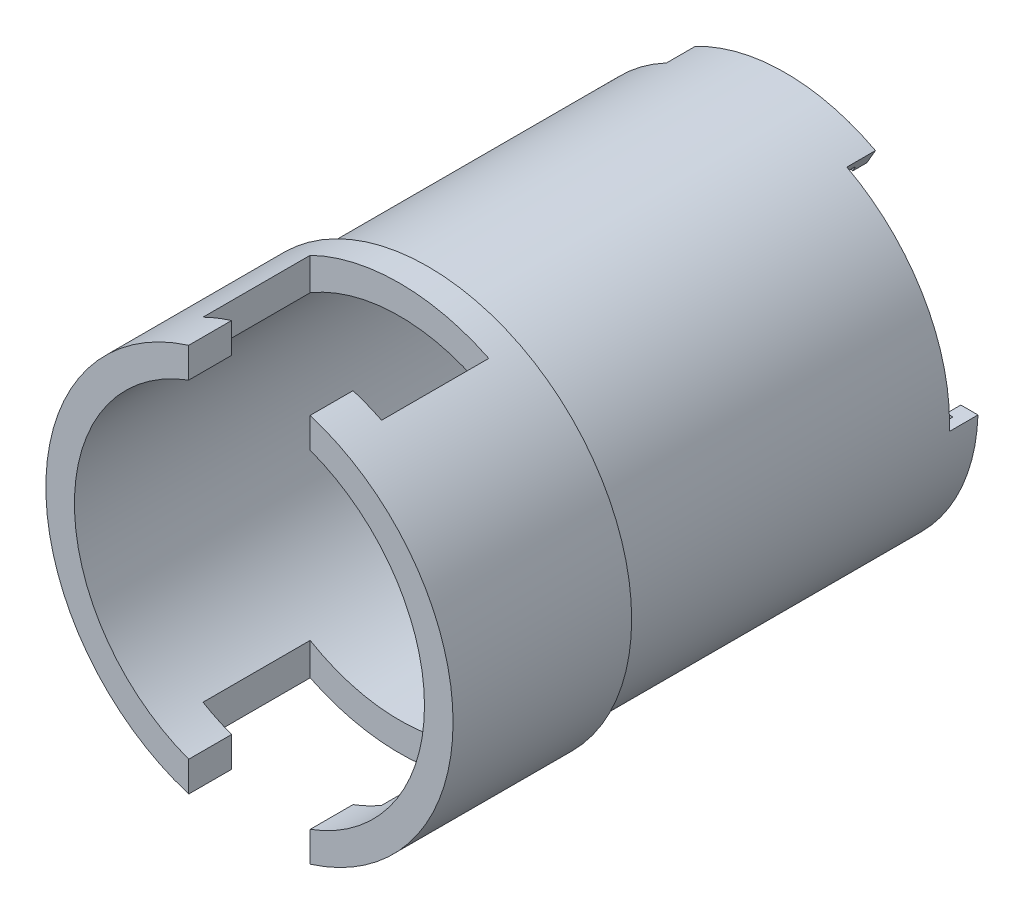
from build123d import *

# Parameters (mm, degrees)
CUT_EXTRUDE_4_DEPTH      = 4
PATTERN_CIRCULAR_1_COUNT = 3
CUT_EXTRUDE_7_DEPTH      = 86.143936954
CUT_EXTRUDE_7_DEPTH_BACK = 86.143936954
SKETCH_12_W              = 25
SKETCH_12_H              = 15
CUT_EXTRUDE_START        = -6
SKETCH_13_W              = 17
SKETCH_13_H              = 62.633188826
CUT_EXTRUDE_12_DEPTH     = 6
CHAMFER_2_SIZE           = 0.3
CHAMFER_2_SIZE2          = 0.519615242
SKETCH_14_W              = 2
SKETCH_14_H              = 10
SKETCH_16_W              = 3
SKETCH_16_H              = 60.736072742
CUT_EXTRUDE_14_DEPTH     = 3
CHAMFER_3_SIZE           = 1
CUT_EXTRUDE_13_REACH     = 102.772


with BuildPart() as part:
    # Эскиз1 → Повернуть1 (revolve)
    with BuildSketch(Plane(origin=(0, 0, 0), x_dir=(0, 0, -1), z_dir=(1, 0, 0)), mode=Mode.PRIVATE) as revolve_1_sk:
        Polygon((0, 24.5), (70.999933333, 24.5), (70.999933333, 25.5), (72.999933333, 25.5), (72.999933333, 24.6), (74.999933333, 24.6), (74.999933333, 27), (25, 27), (25, 28.5), (0, 28.5), align=None)
    revolve(revolve_1_sk.sketch.rotate(Axis((0, 0, 0), (0, 0, -1)), 90), axis=Axis((0, 0, 0), (0, 0, -1)))

    # Эскиз9 → Вырез-Вытянуть4 (cut)
    with BuildSketch(Plane(origin=(0, 0, -74.999933333), x_dir=(-1, 0, 0), z_dir=(0, 0, -1))):
        with BuildLine():
            ThreePointArc((24.6, 0), (24.594916073, -0.500103353), (24.579666393, -1))
            Line((24.579666393, -1), (26.981475126, -1))
            ThreePointArc((26.981475126, -1), (26.995368384, -0.500085785), (27, 0))
            ThreePointArc((27, 0), (23.128631913, 13.930771186), (12.624712159, 23.866642891))
            Line((12.624712159, 23.866642891), (11.423807793, 21.786615513))
            ThreePointArc((11.423807793, 21.786615513), (21.049770447, 12.730560245), (24.6, 0))
        make_face()
    cut_extrude_4 = extrude(amount=-CUT_EXTRUDE_4_DEPTH, mode=Mode.SUBTRACT)

    # Круговой массив1: Вырез-Вытянуть4 ×3 about axis
    pattern_circular_1_axis = Axis((0, 0, 0), (0, 0, 1))
    for i in range(1, PATTERN_CIRCULAR_1_COUNT):
        add(cut_extrude_4.rotate(pattern_circular_1_axis, i * 360 / PATTERN_CIRCULAR_1_COUNT), mode=Mode.SUBTRACT)

    # Эскиз12 → Вырез-Вытянуть7 (cut, two sides: drawn at the far end of the back side and taken through both)
    with BuildSketch(Plane(origin=(0, 0, 0), x_dir=(1, 0, 0), z_dir=(0, 1, 0)).offset(-CUT_EXTRUDE_7_DEPTH_BACK)):
        with Locations((0, 13.5)):
            Rectangle(SKETCH_12_W, SKETCH_12_H)
    extrude(amount=CUT_EXTRUDE_7_DEPTH + CUT_EXTRUDE_7_DEPTH_BACK, mode=Mode.SUBTRACT)

    # Эскиз13 → Вырез-Вытянуть12 (cut)
    with BuildSketch(Plane.XY.offset(CUT_EXTRUDE_START)):
        Rectangle(SKETCH_13_W, SKETCH_13_H)
    extrude(amount=CUT_EXTRUDE_12_DEPTH, mode=Mode.SUBTRACT)

    # Фаска2
    chamfer_2_edges = [part.edges().sort_by_distance(p)[0] for p in [
        (-24.5, 0, -70.999933333),
    ]]
    chamfer_2_side = [part.faces().sort_by_distance(p)[0] for p in [
        (0, 24.746856587, -70.999933333),
    ]]
    chamfer(chamfer_2_edges, length=CHAMFER_2_SIZE, length2=CHAMFER_2_SIZE2, reference=chamfer_2_side[0])

    # Эскиз14 → Вырез-Повернуть1 (revolve, cut)
    with BuildSketch(Plane(origin=(0, 0, 0), x_dir=(0, 0, 1), z_dir=(-0.8986841034993474, -0.4385964912280702, 0))):
        with Locations((-21.5, -31.5)):
            Rectangle(SKETCH_14_W, SKETCH_14_H)
    revolve(axis=Axis((16.00877193, -32.801969778, -26.23783224), (0, 0, 1)), mode=Mode.SUBTRACT)

    # Эскиз16 → Вырез-Вытянуть14 (cut)
    with BuildSketch(Plane(origin=(-19.091883092, -19.091883092, 0), x_dir=(0, 0, 1), z_dir=(-0.7071067811865464, -0.7071067811865488, 0))):
        with Locations((-64.499933333, 0.711195231)):
            Rectangle(SKETCH_16_W, SKETCH_16_H)
    extrude(amount=-CUT_EXTRUDE_14_DEPTH, mode=Mode.SUBTRACT)

    # Фаска3
    # the kernel refuses this chamfer: 1 mm, written as the material it takes off along each edge
    with BuildSketch(Plane(origin=(-20.452659818, -13.488465679, -62.999933333), x_dir=(-0.5333586097594283, 0.8458892323439812, 0), z_dir=(0, 0, -1))) as chamfer_3_piece_1:
        with BuildLine():
            Line((1.002291345, 0), (CHAMFER_3_SIZE * 0.975275502088, -CHAMFER_3_SIZE * 0.220992522558))
            Line((CHAMFER_3_SIZE * 0.975275502088, -CHAMFER_3_SIZE * 0.220992522558), (0, 0))
            ThreePointArc((0, 0), (0.503575038, -0.005125864), (1.002291345, 0))
        make_face()
    extrude(amount=3, mode=Mode.SUBTRACT)
    with BuildSketch(Plane(origin=(-13.488465679, -20.452659818, -62.999933333), x_dir=(0.8458892323439845, -0.5333586097594231, 0), z_dir=(0, 0, -1))) as chamfer_3_piece_2:
        with BuildLine():
            Line((1.002291345, 0), (CHAMFER_3_SIZE * 0.975275502088, CHAMFER_3_SIZE * 0.220992522558))
            Line((CHAMFER_3_SIZE * 0.975275502088, CHAMFER_3_SIZE * 0.220992522558), (0, 0))
            ThreePointArc((0, 0), (0.503575038, 0.005125864), (1.002291345, 0))
        make_face()
    extrude(amount=3, mode=Mode.SUBTRACT)

    # Эскиз15 → Вырез-Вытянуть13 (cut, up to next)
    with BuildSketch(Plane(origin=(-19.091883092, -19.091883092, 0), x_dir=(0, 0, 1), z_dir=(-0.7071067811865464, -0.7071067811865488, 0)), mode=Mode.PRIVATE) as cut_extrude_13_sk1:
        with BuildLine():
            Line((-63, 6), (-63, -6))
            ThreePointArc((-63, -6), (-64.5, -7.5), (-66, -6))
            Line((-66, -6), (-66, 6))
            ThreePointArc((-66, 6), (-64.5, 7.5), (-63, 6))
        make_face()
    cut_extrude_13_tool1 = extrude(cut_extrude_13_sk1.sketch, amount=-CUT_EXTRUDE_13_REACH, mode=Mode.PRIVATE) & part.part
    add(cut_extrude_13_tool1.solids().sort_by_distance((-19.091883, -19.091883, -64.5))[0], mode=Mode.SUBTRACT)


solid = part.part
